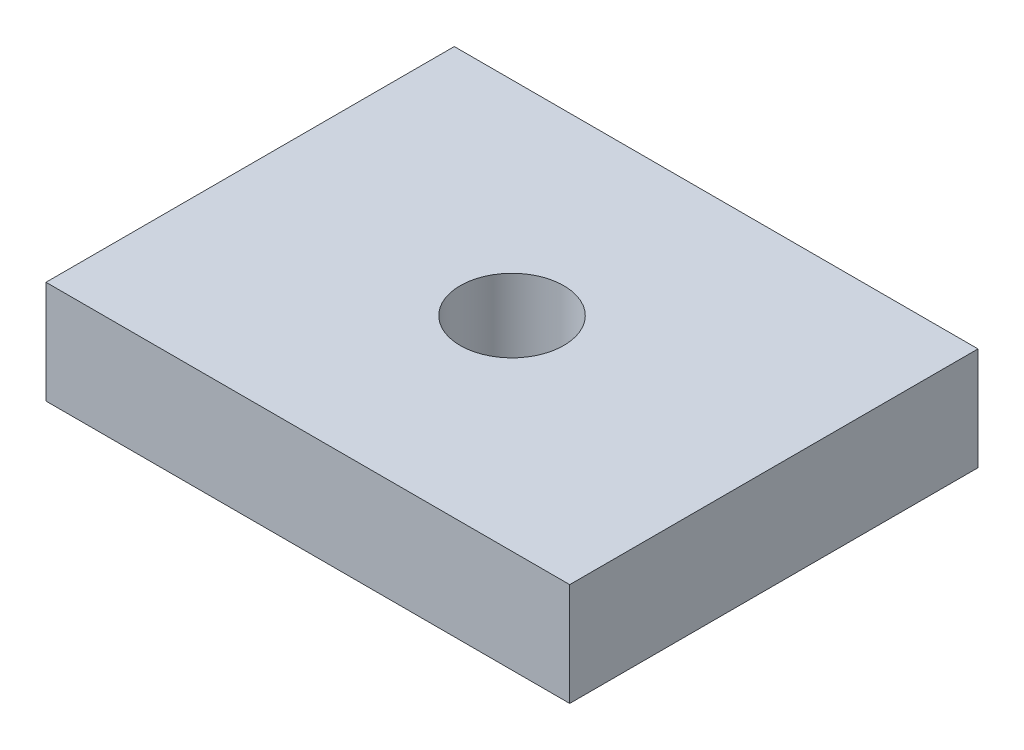
from build123d import *

# Parameters (mm, degrees)
SKETCH1_W           = 50.884502354
SKETCH1_H           = 39.669825848
BOSS_EXTRUDE1_DEPTH = 10
SKETCH2_R           = 5.03656923
CUT_EXTRUDE1_DEPTH  = 10


with BuildPart() as part:
    # Sketch1 → Boss-Extrude1 (new body)
    with BuildSketch(Plane(origin=(0, 0, 0), x_dir=(1, 0, 0), z_dir=(0, 1, 0))):
        Rectangle(SKETCH1_W, SKETCH1_H)
    extrude(amount=BOSS_EXTRUDE1_DEPTH)

    # Sketch2 → Cut-Extrude1 (cut)
    with BuildSketch(Plane(origin=(0, 10, 0), x_dir=(1, 0, 0), z_dir=(0, 1, 0))):
        Circle(SKETCH2_R)
    extrude(amount=-CUT_EXTRUDE1_DEPTH, mode=Mode.SUBTRACT)


solid = part.part
